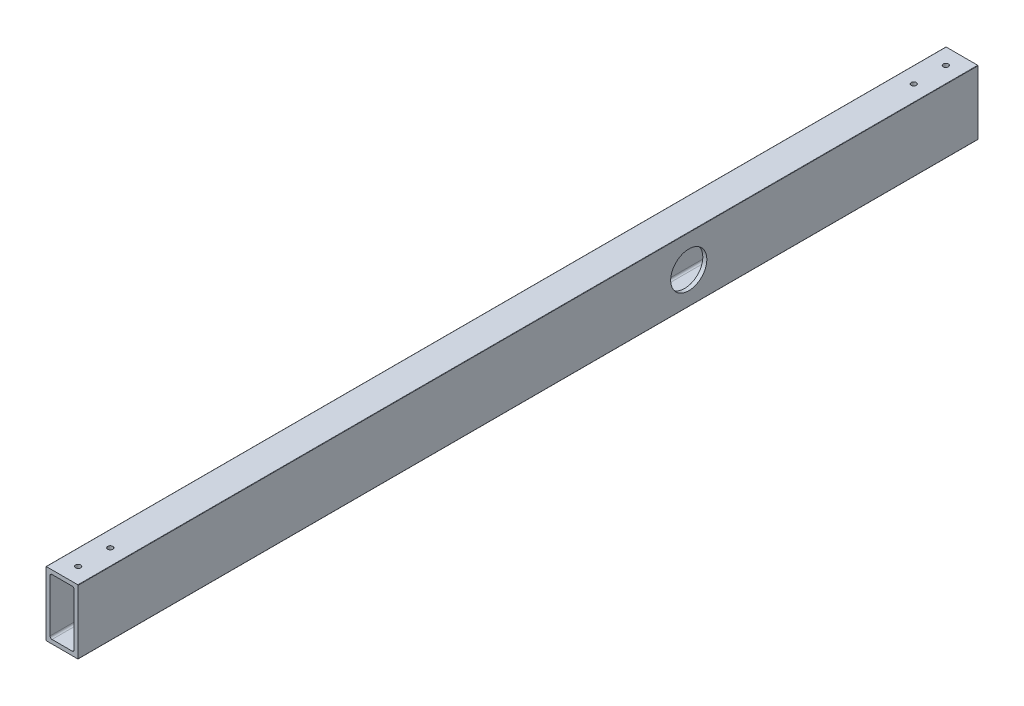
from build123d import *

# Parameters (mm, degrees)
BOSS_EXTRUDE1_DEPTH = 711.2
SKETCH2_R           = 2.032
CUT_EXTRUDE1_DEPTH  = 714.464252784
SKETCH5_R           = 14.2875
CUT_EXTRUDE2_DEPTH  = 714.464252784


with BuildPart() as part:
    # Sketch1 → Boss-Extrude1 (new body)
    with BuildSketch(Plane(origin=(0, 0, 0), x_dir=(-1, 0, 0), z_dir=(0, 0, -1))):
        with BuildLine():
            Line((0, 0.254), (0, 50.546))
            ThreePointArc((0, 50.546), (-0.074394878, 50.725605122), (-0.254, 50.8))
            Line((-0.254, 50.8), (-25.146, 50.8))
            ThreePointArc((-25.146, 50.8), (-25.325605122, 50.725605122), (-25.4, 50.546))
            Line((-25.4, 50.546), (-25.4, 0.254))
            ThreePointArc((-25.4, 0.254), (-25.325605122, 0.074394878), (-25.146, 0))
            Line((-25.146, 0), (-0.254, 0))
            ThreePointArc((-0.254, 0), (-0.074394878, 0.074394878), (0, 0.254))
        make_face()
        with BuildLine():
            Line((-3.175, 46.0375), (-3.175, 4.7625))
            ThreePointArc((-3.175, 4.7625), (-3.639967985, 3.639967985), (-4.7625, 3.175))
            Line((-4.7625, 3.175), (-20.6375, 3.175))
            ThreePointArc((-20.6375, 3.175), (-21.760032015, 3.639967985), (-22.225, 4.7625))
            Line((-22.225, 4.7625), (-22.225, 46.0375))
            ThreePointArc((-22.225, 46.0375), (-21.760032015, 47.160032015), (-20.6375, 47.625))
            Line((-20.6375, 47.625), (-4.7625, 47.625))
            ThreePointArc((-4.7625, 47.625), (-3.639967985, 47.160032015), (-3.175, 46.0375))
        make_face(mode=Mode.SUBTRACT)
    extrude(amount=-BOSS_EXTRUDE1_DEPTH)

    # Sketch2 → Cut-Extrude1 (cut, through all)
    with BuildSketch(Plane(origin=(0, 50.8, 0), x_dir=(1, 0, 0), z_dir=(0, 1, 0))):
        with Locations((12.7, -698.5)):
            Circle(SKETCH2_R)
        with Locations((12.7, -673.1)):
            Circle(SKETCH2_R)
        with Locations((12.7, -38.1)):
            Circle(SKETCH2_R)
        with Locations((12.7, -12.7)):
            Circle(SKETCH2_R)
    extrude(amount=-CUT_EXTRUDE1_DEPTH, mode=Mode.SUBTRACT)

    # Sketch5 → Cut-Extrude2 (cut, through all)
    with BuildSketch(Plane(origin=(25.4, 0, 0), x_dir=(0, 0, -1), z_dir=(1, 0, 0))):
        with Locations((-228.6, 25.146)):
            Circle(SKETCH5_R)
    extrude(amount=-CUT_EXTRUDE2_DEPTH, mode=Mode.SUBTRACT)


solid = part.part
